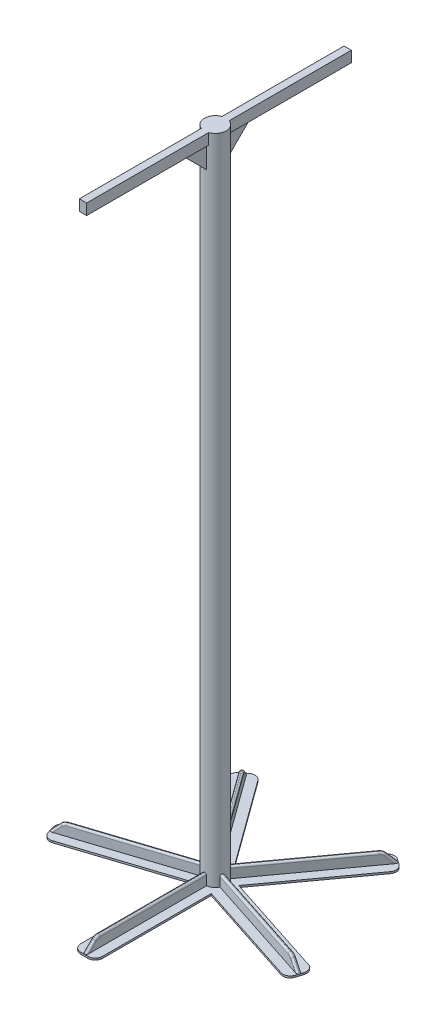
from build123d import *

# Parameters (mm, degrees)
SKETCH1_R           = 152.4
BOSS_EXTRUDE1_DEPTH = 9144
BOSS_EXTRUDE3_DEPTH = 1828.8
CUT_EXTRUDE1_DEPTH  = 9327.781775082
FILLET10_R          = 101.6
FILLET12_R          = 25.4
CIRPATTERN10_COUNT  = 5
SKETCH4_W           = 101.6
SKETCH4_H           = 152.4
BOSS_EXTRUDE5_DEPTH = 1847.85
BOSS_EXTRUDE6_DEPTH = 25.4
CIRPATTERN11_COUNT  = 2


with BuildPart() as part:
    # Sketch1 → Boss-Extrude1 (new body)
    with BuildSketch(Plane(origin=(0, 0, 0), x_dir=(1, 0, 0), z_dir=(0, 1, 0))):
        with Locations(Location((0, 0, 0), (0, 0, 270))):
            Circle(SKETCH1_R)
    extrude(amount=BOSS_EXTRUDE1_DEPTH)

    # Sketch2 → Boss-Extrude3 (add)
    with BuildSketch(Plane.XY):
        Polygon((-152.4, 0), (-152.4, 25.4), (-25.4, 25.4), (-25.4, 177.8), (25.4, 177.8), (25.4, 25.4), (152.4, 25.4), (152.4, 0), align=None)
    extrude(amount=BOSS_EXTRUDE3_DEPTH)

    # Sketch3 → Cut-Extrude1 (cut, through all)
    with BuildSketch(Plane(origin=(25.4, 0, 0), x_dir=(0, 0, -1), z_dir=(1, 0, 0))):
        Polygon((-1828.8, 25.4), (-1676.4, 177.8), (-1828.8, 177.8), align=None)
    extrude(amount=-CUT_EXTRUDE1_DEPTH, mode=Mode.SUBTRACT)

    # Fillet10
    fillet10_edges = [part.edges().sort_by_distance(p)[0] for p in [
        (152.4, 12.7, 1828.8),
        (-152.4, 12.7, 1828.8),
        (0, 177.8, 1676.4),
    ]]
    fillet(fillet10_edges, radius=FILLET10_R)

    # Fillet12
    fillet12_edges = [part.edges().sort_by_distance(p)[0] for p in [
        (-25.4, 86.721024484, 1767.478975516),
        (-25.4, 170.066160503, 1673.196538791),
        (25.4, 86.721024484, 1767.478975516),
        (25.4, 170.066160503, 1673.196538791),
        (-25.4, 177.8, 892.292164277),
        (25.4, 177.8, 892.292164277),
    ]]
    fillet(fillet12_edges, radius=FILLET12_R - 0.0001)  # a hair under: the kernel refuses the full size


with BuildPart() as cirpattern10_1:
    # CirPattern10: pattern copy
    add(part.part.rotate(Axis((0, 0, 0), (0, 1, 0)), 1 * 360 / CIRPATTERN10_COUNT))


with BuildPart() as cirpattern10_2:
    # CirPattern10: pattern copy
    add(part.part.rotate(Axis((0, 0, 0), (0, 1, 0)), 2 * 360 / CIRPATTERN10_COUNT))


with BuildPart() as cirpattern10_3:
    # CirPattern10: pattern copy
    add(part.part.rotate(Axis((0, 0, 0), (0, 1, 0)), 3 * 360 / CIRPATTERN10_COUNT))


with BuildPart() as cirpattern10_4:
    # CirPattern10: pattern copy
    add(part.part.rotate(Axis((0, 0, 0), (0, 1, 0)), 4 * 360 / CIRPATTERN10_COUNT))


with BuildPart() as part_1:
    add(part.part)

    add(cirpattern10_1.part)  # Boss-Extrude5 merges CirPattern10_1

    add(cirpattern10_2.part)  # Boss-Extrude5 merges CirPattern10_2

    add(cirpattern10_3.part)  # Boss-Extrude5 merges CirPattern10_3

    add(cirpattern10_4.part)  # Boss-Extrude5 merges CirPattern10_4
    # Sketch4 → Boss-Extrude5 (add, symmetric)
    with BuildSketch(Plane.XY):
        with Locations((0, 9067.8)):
            Rectangle(SKETCH4_W, SKETCH4_H)
    extrude(amount=BOSS_EXTRUDE5_DEPTH, both=True)

    # Sketch5 → Boss-Extrude6 (add, symmetric)
    with BuildSketch(Plane(origin=(0, 0, 0), x_dir=(0, 0, -1), z_dir=(1, 0, 0))):
        Polygon((0, 9144), (0, 8534.4), (-609.6, 9144), align=None)
    boss_extrude6 = extrude(amount=BOSS_EXTRUDE6_DEPTH, both=True)

    # CirPattern11: Boss-Extrude6 ×2 about axis
    cirpattern11_axis = Axis((0, 9144, 0), (0, 1, 0))
    for i in range(1, CIRPATTERN11_COUNT):
        add(boss_extrude6.rotate(cirpattern11_axis, i * 360 / CIRPATTERN11_COUNT))


solid = part_1.part
